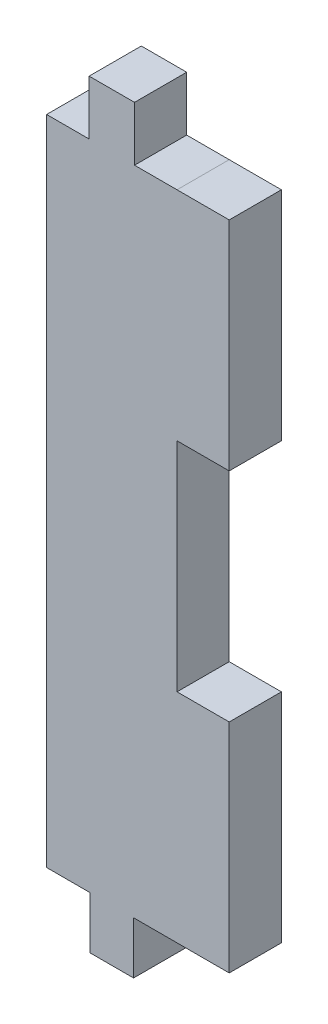
from build123d import *

# Parameters (mm, degrees)
SKETCH1_W           = 3.479672363
SKETCH1_H           = 4.175606835
SKETCH1_W_2         = 3.333333333
SKETCH1_H_2         = 4
BOSS_EXTRUDE1_DEPTH = 4
CAVITY1_START       = -27.230031218
CAVITY1_OUTLINE_W   = 16.666666667
CAVITY1_OUTLINE_H   = 4
CAVITY1_DEPTH       = 4


# Read off the part's stored shape, not the designer's step: Cavity1
with BuildPart() as part:
    # Sketch1 → Boss-Extrude1 (new body)
    with BuildSketch(Plane.XY):
        with Locations((-32.230031219, -14.092199994)):
            Rectangle(SKETCH1_W, SKETCH1_H)
        Polygon((-33.9698674, -20.355610246), (-33.9698674, -16.180003411), (-37.230031218, -16.180003411), (-37.230031218, -66.180003411), (-33.896697885, -66.180003411), (-33.896697885, -62.180003411), (-30.563364552, -62.180003411), (-30.563364552, -66.180003411), (-27.230031218, -66.180003411), (-27.230031218, -16.180003411), (-30.490195037, -16.180003411), (-30.490195037, -20.355610246), align=None)
        with Locations((-32.230031219, -18.267806828)):
            Rectangle(SKETCH1_W, SKETCH1_H)
        Polygon((-23.230031218, -16.180335931), (-27.230031218, -16.180003411), (-27.230031218, -66.180003411), (-23.230031218, -66.180003411), align=None)
        with Locations((-32.230031219, -64.180003411)):
            Rectangle(SKETCH1_W_2, SKETCH1_H_2)
        with Locations((-32.230031219, -68.180003411)):
            Rectangle(SKETCH1_W_2, SKETCH1_H_2)
    extrude(amount=BOSS_EXTRUDE1_DEPTH)

    # Cavity1 outline → Cavity1 (cut)
    with BuildSketch(Plane.YZ.offset(CAVITY1_START)):
        with Locations((-41.180335932, 2)):
            Rectangle(CAVITY1_OUTLINE_W, CAVITY1_OUTLINE_H)
    extrude(amount=CAVITY1_DEPTH, mode=Mode.SUBTRACT)


solid = part.part
